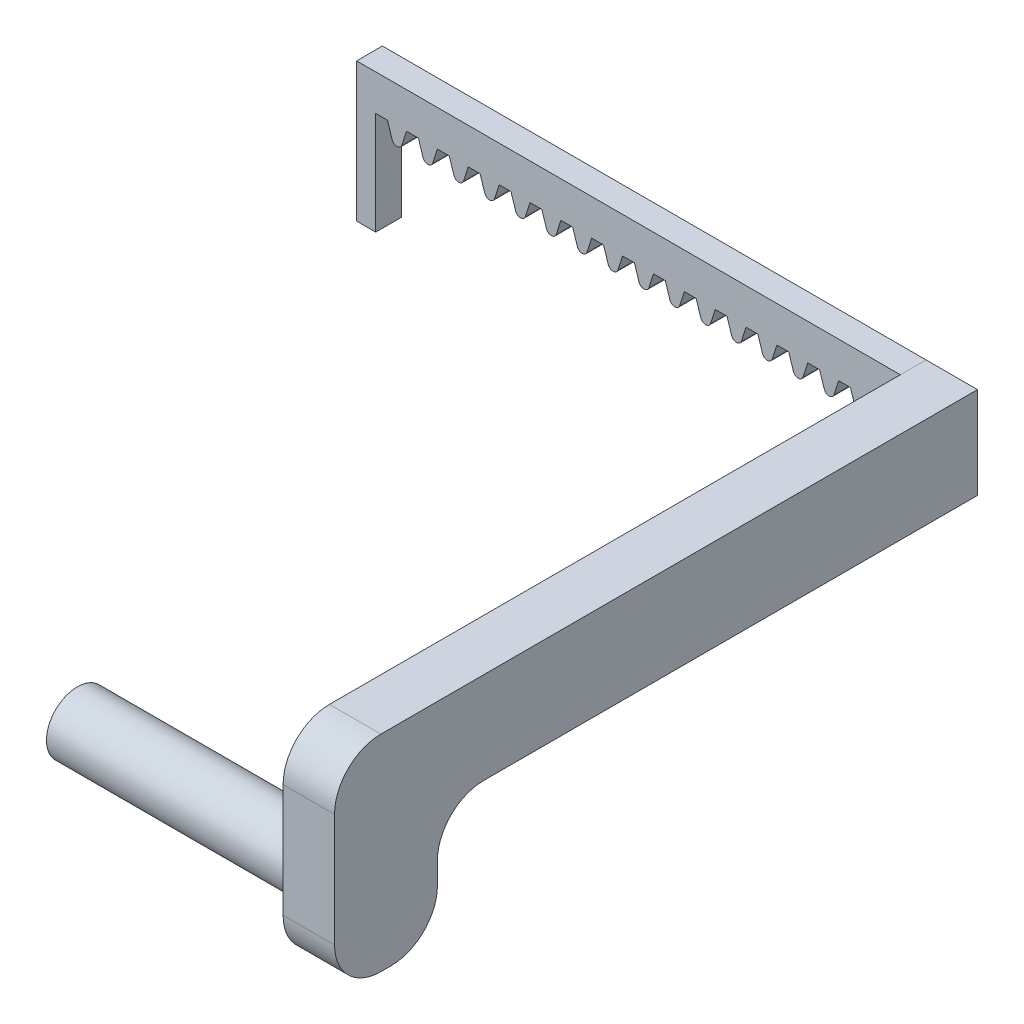
from build123d import *

# Parameters (mm, degrees)
DODANIE_WYCI_GNI_CIE1_DEPTH = 5
SZKIC3_W                    = 10
SZKIC3_H                    = 40
DODANIE_WYCI_GNI_CIE2_DEPTH = 120
SZKIC4_R                    = 6
DODANIE_WYCI_GNI_CIE3_DEPTH = 50
PODZIEL1_START              = 105.7
PODZIEL1_OUTLINE_W          = 40
PODZIEL1_OUTLINE_H          = 125
PODZIEL1_DEPTH              = 10
PODZIEL1_START_2            = 55.7
PODZIEL1_2_OUTLINE_R        = 6
PODZIEL1_2_DEPTH            = 50
PODZIEL1_3_OUTLINE_W        = 40
PODZIEL1_3_OUTLINE_H        = 125
PODZIEL1_3_DEPTH            = 10
PODZIEL1_4_OUTLINE_R        = 6
PODZIEL1_4_DEPTH            = 50
WYTNIJ_WYCI_GNI_CIE1_DEPTH  = 167.992484861
SZKIC7_W                    = 3.7
SZKIC7_H                    = 26.99
DODANIE_WYCI_GNI_CIE4_DEPTH = 5


# Read off the part's stored shape, not the designer's step: Podziel1
with BuildPart() as part:
    # Szkic2 → Dodanie-wyciągnięcie1 (new body)
    with BuildSketch(Plane.XY):
        with BuildLine():
            Line((9.7, 0), (12, 0))
            Line((12, 0), (12.897580547, -2.804790395))
            ThreePointArc((12.897580547, -2.804790395), (13.85, -3.5), (14.802419453, -2.804790395))
            Line((14.802419453, -2.804790395), (15.7, 0))
            Line((15.7, 0), (18, 0))
            Line((18, 0), (18.897580547, -2.804790395))
            ThreePointArc((18.897580547, -2.804790395), (19.85, -3.5), (20.802419453, -2.804790395))
            Line((20.802419453, -2.804790395), (21.7, 0))
            Line((21.7, 0), (24, 0))
            Line((24, 0), (24.897580547, -2.804790395))
            ThreePointArc((24.897580547, -2.804790395), (25.85, -3.5), (26.802419453, -2.804790395))
            Line((26.802419453, -2.804790395), (27.7, 0))
            Line((27.7, 0), (30, 0))
            Line((30, 0), (30.897580547, -2.804790395))
            ThreePointArc((30.897580547, -2.804790395), (31.85, -3.5), (32.802419453, -2.804790395))
            Line((32.802419453, -2.804790395), (33.7, 0))
            Line((33.7, 0), (36, 0))
            Line((36, 0), (36.897580547, -2.804790395))
            ThreePointArc((36.897580547, -2.804790395), (37.85, -3.5), (38.802419453, -2.804790395))
            Line((38.802419453, -2.804790395), (39.7, 0))
            Line((39.7, 0), (42, 0))
            Line((42, 0), (42.897580547, -2.804790395))
            ThreePointArc((42.897580547, -2.804790395), (43.85, -3.5), (44.802419453, -2.804790395))
            Line((44.802419453, -2.804790395), (45.7, 0))
            Line((45.7, 0), (48, 0))
            Line((48, 0), (48.897580547, -2.804790395))
            ThreePointArc((48.897580547, -2.804790395), (49.85, -3.5), (50.802419453, -2.804790395))
            Line((50.802419453, -2.804790395), (51.7, 0))
            Line((51.7, 0), (54, 0))
            Line((54, 0), (54.897580547, -2.804790395))
            ThreePointArc((54.897580547, -2.804790395), (55.85, -3.5), (56.802419453, -2.804790395))
            Line((56.802419453, -2.804790395), (57.7, 0))
            Line((57.7, 0), (60, 0))
            Line((60, 0), (60.897580547, -2.804790395))
            ThreePointArc((60.897580547, -2.804790395), (61.85, -3.5), (62.802419453, -2.804790395))
            Line((62.802419453, -2.804790395), (63.7, 0))
            Line((63.7, 0), (66, 0))
            Line((66, 0), (66.897580547, -2.804790395))
            ThreePointArc((66.897580547, -2.804790395), (67.85, -3.5), (68.802419453, -2.804790395))
            Line((68.802419453, -2.804790395), (69.7, 0))
            Line((69.7, 0), (72, 0))
            Line((72, 0), (72.897580547, -2.804790395))
            ThreePointArc((72.897580547, -2.804790395), (73.85, -3.5), (74.802419453, -2.804790395))
            Line((74.802419453, -2.804790395), (75.7, 0))
            Line((75.7, 0), (78, 0))
            Line((78, 0), (78.897580547, -2.804790395))
            ThreePointArc((78.897580547, -2.804790395), (79.85, -3.5), (80.802419453, -2.804790395))
            Line((80.802419453, -2.804790395), (81.7, 0))
            Line((81.7, 0), (84, 0))
            Line((84, 0), (84.897580547, -2.804790395))
            ThreePointArc((84.897580547, -2.804790395), (85.85, -3.5), (86.802419453, -2.804790395))
            Line((86.802419453, -2.804790395), (87.7, 0))
            Line((87.7, 0), (90, 0))
            Line((90, 0), (90.897580547, -2.804790395))
            ThreePointArc((90.897580547, -2.804790395), (91.85, -3.5), (92.802419453, -2.804790395))
            Line((92.802419453, -2.804790395), (93.7, 0))
            Line((93.7, 0), (96, 0))
            Line((96, 0), (96.897580547, -2.804790395))
            ThreePointArc((96.897580547, -2.804790395), (97.85, -3.5), (98.802419453, -2.804790395))
            Line((98.802419453, -2.804790395), (99.7, 0))
            Line((99.7, 0), (102, 0))
            Line((102, 0), (102.897580547, -2.804790395))
            ThreePointArc((102.897580547, -2.804790395), (103.85, -3.5), (104.802419453, -2.804790395))
            Line((104.802419453, -2.804790395), (105.7, 0))
            Line((105.7, 0), (105.7, -33))
            Line((105.7, -33), (115.7, -33))
            Line((115.7, -33), (115.7, 7))
            Line((115.7, 7), (105.7, 7))
            Line((105.7, 7), (0, 7))
            Line((0, 7), (0, 0))
            Line((0, 0), (0.897580547, -2.804790395))
            ThreePointArc((0.897580547, -2.804790395), (1.85, -3.5), (2.802419453, -2.804790395))
            Line((2.802419453, -2.804790395), (3.7, 0))
            Line((3.7, 0), (6, 0))
            Line((6, 0), (6.897580547, -2.804790395))
            ThreePointArc((6.897580547, -2.804790395), (7.85, -3.5), (8.802419453, -2.804790395))
            Line((8.802419453, -2.804790395), (9.7, 0))
        make_face()
    extrude(amount=DODANIE_WYCI_GNI_CIE1_DEPTH)

    # Szkic3 → Dodanie-wyciągnięcie2 (add)
    with BuildSketch(Plane.XY.offset(5)):
        with Locations((110.7, -13)):
            Rectangle(SZKIC3_W, SZKIC3_H)
    extrude(amount=DODANIE_WYCI_GNI_CIE2_DEPTH)

    # Szkic4 → Dodanie-wyciągnięcie3 (add)
    with BuildSketch(Plane.ZY.offset(-105.7)):
        with Locations(Location((115, -21.535, 0), (0, 0, 90))):
            Circle(SZKIC4_R)
    extrude(amount=DODANIE_WYCI_GNI_CIE3_DEPTH)

    # Podziel1 outline → Podziel1 (cut)
    with BuildSketch(Plane.YZ.offset(PODZIEL1_START)):
        with Locations((-13, 62.5)):
            Rectangle(PODZIEL1_OUTLINE_W, PODZIEL1_OUTLINE_H)
    extrude(amount=PODZIEL1_DEPTH, mode=Mode.SUBTRACT)

    # Podziel1 2 outline → Podziel1 2 (cut)
    with BuildSketch(Plane.YZ.offset(PODZIEL1_START_2)):
        with Locations((-21.535, 115)):
            Circle(PODZIEL1_2_OUTLINE_R)
    extrude(amount=PODZIEL1_2_DEPTH, mode=Mode.SUBTRACT)

    # Szkic7 → Dodanie-wyciągnięcie4 (add)
    with BuildSketch(Plane.XY.offset(5)):
        with Locations((1.85, -6.495)):
            Rectangle(SZKIC7_W, SZKIC7_H)
    extrude(amount=-DODANIE_WYCI_GNI_CIE4_DEPTH)


with BuildPart() as body_2:
    # Podziel1 3 outline → Podziel1 3 (new body)
    with BuildSketch(Plane.YZ.offset(PODZIEL1_START)):
        with Locations((-13, 62.5)):
            Rectangle(PODZIEL1_3_OUTLINE_W, PODZIEL1_3_OUTLINE_H)
    extrude(amount=PODZIEL1_3_DEPTH)

    # Szkic6 → Wytnij-wyciągnięcie1 (cut, through all)
    with BuildSketch(Plane.ZY.offset(-105.7)):
        with BuildLine():
            Line((0, -10.813339386), (96, -10.813339386))
            ThreePointArc((96, -10.813339386), (102.363961031, -13.449378356), (105, -19.813339386))
            Line((105, -19.813339386), (105, -24))
            ThreePointArc((105, -24), (107.636038969, -30.363961031), (114, -33))
            Line((114, -33), (116, -33))
            ThreePointArc((116, -33), (122.363961031, -30.363961031), (125, -24))
            Line((125, -24), (125, -2))
            ThreePointArc((125, -2), (122.363961031, 4.363961031), (116, 7))
            Line((116, 7), (106.876347747, 7))
            Line((106.876347747, 7), (106.876347747, 17.227367306))
            Line((106.876347747, 17.227367306), (133.63078349, 17.227367306))
            Line((133.63078349, 17.227367306), (133.63078349, -45.542655015))
            Line((133.63078349, -45.542655015), (0, -45.542655015))
            Line((0, -45.542655015), (0, -10.813339386))
        make_face()
    extrude(amount=-WYTNIJ_WYCI_GNI_CIE1_DEPTH, mode=Mode.SUBTRACT)


with BuildPart() as body_3:
    # Podziel1 4 outline → Podziel1 4 (new body)
    with BuildSketch(Plane.YZ.offset(PODZIEL1_START_2)):
        with Locations((-21.535, 115)):
            Circle(PODZIEL1_4_OUTLINE_R)
    extrude(amount=PODZIEL1_4_DEPTH)


solid = Compound([part.part, body_2.part, body_3.part])
